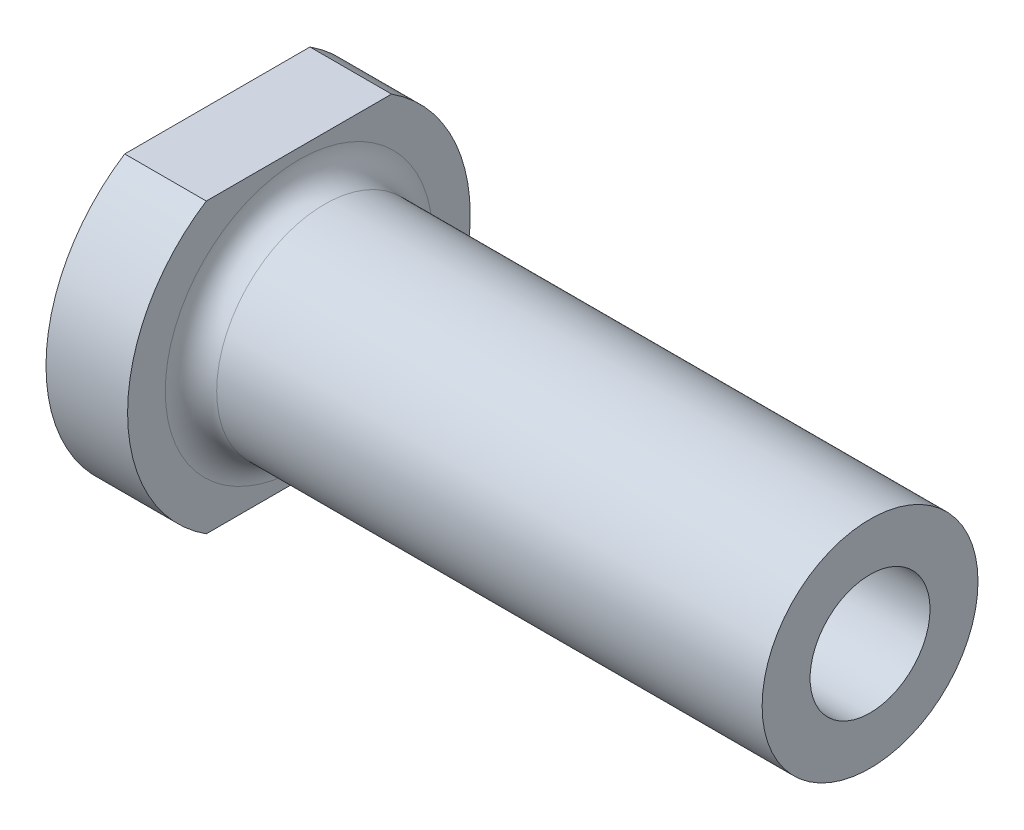
from build123d import *

# Parameters (mm, degrees)
FILLET1_R                            = 1.5
F_5_16_18_MAKE_SURE_TO_CHANGE_THIS_D = 7
CUT_EXTRUDE1_DEPTH                   = 41.640004891


with BuildPart() as part:
    # Sketch1 → Revolve1 (revolve)
    with BuildSketch(Plane.XY):
        Polygon((0, 0), (38.1, 0), (38.1, 6.299999973), (4.7625, 6.299999973), (4.7625, 9.999999939), (0, 9.999999939), align=None)
    revolve(axis=Axis((0, 0, 0), (-1, 0, 0)))

    # Fillet1
    fillet1_edges = [part.edges().sort_by_distance(p)[0] for p in [
        (4.7625, -6.299999973, 0),
    ]]
    fillet(fillet1_edges, radius=FILLET1_R)

    # 5/16-18 MAKE SURE TO CHANGE THIS (through all)
    with Locations(Plane(origin=(38.1, 0, 0), x_dir=(0, 0, -1), z_dir=(1, 0, 0))):
        with Locations((0, 0)):
            Hole(F_5_16_18_MAKE_SURE_TO_CHANGE_THIS_D / 2)

    # Sketch4 → Cut-Extrude1 (cut, through all)
    with BuildSketch(Plane.ZY):
        with BuildLine():
            Line((-5.406463128, 8.412499939), (5.406463128, 8.412499939))
            ThreePointArc((5.406463128, 8.412499939), (0, 9.999999939), (-5.406463128, 8.412499939))
        make_face()
        with BuildLine():
            Line((5.406463128, -8.412499939), (-5.406463128, -8.412499939))
            ThreePointArc((-5.406463128, -8.412499939), (0, -9.999999939), (5.406463128, -8.412499939))
        make_face()
    extrude(amount=-CUT_EXTRUDE1_DEPTH, mode=Mode.SUBTRACT)


solid = part.part
